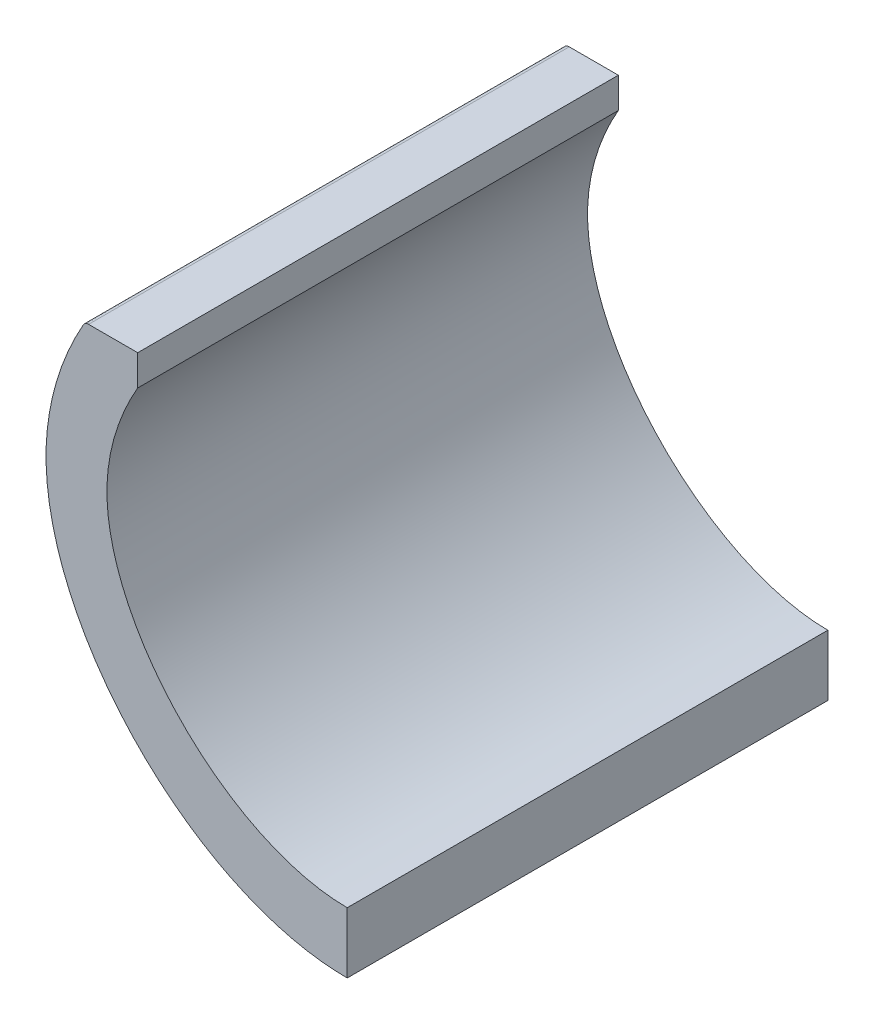
from build123d import *

# Parameters (mm, degrees)
STOCK_PAYLOAD_BAY_1_START = 331.59
STOCK_PAYLOAD_BAY_1_DEPTH = 236.810025
FILLET1_R                 = 3


# Read off the part's stored shape, not the designer's step: Stock-Payload_bay-1
with BuildPart() as part:
    # Stock-Payload_bay-1 outline → Stock-Payload_bay-1 (new body)
    with BuildSketch(Plane.XY.offset(STOCK_PAYLOAD_BAY_1_START)):
        with BuildLine():
            Line((-103.230490722, 66.8), (-129.177697638, 66.8))
            add(Edge.make_bspline(
                [(-129.177697638, 66.8), (-129.620986666, 66.036144557), (-131.753376368, 62.291446965), (-135.362753212, 55.314865151), (-139.587846981, 45.554685292), (-143.085982258, 35.480371977), (-145.768738443, 25.217208127), (-147.598187785, 14.756187222), (-148.496219867, 4.04425788), (-148.371326584, -6.539331808), (-147.273953028, -17.050292148), (-145.252404256, -27.49737261), (-141.377832301, -41.272176246), (-136.008827451, -54.314250652), (-129.322136126, -66.786199843), (-123.638884314, -75.879723374), (-117.410839628, -84.564797072), (-108.463999756, -95.539360338), (-96.108090183, -108.196956109), (-79.329305457, -121.670886231), (-64.299288616, -130.914132781), (-51.579681827, -137.079745612), (-41.624388524, -141.055777896), (-31.440015392, -144.248668387), (-21.132268456, -146.591416073), (-12.406389282, -147.811759094), (-5.350229412, -148.314037414), (-1.78044168, -148.400358856), (0, -148.400358856)],
                knots=[0.118137711, 0.118137711, 0.118137711, 0.118137711, 0.125950211, 0.15625, 0.1875, 0.21875, 0.25, 0.28125, 0.3125, 0.34375, 0.375, 0.40625, 0.4375, 0.5, 0.53125, 0.5625, 0.59375, 0.625, 0.6875, 0.75, 0.8125, 0.84375, 0.875, 0.90625, 0.9375, 0.96875, 0.984375, 1, 1, 1, 1], degree=3))
            Line((0, -148.400358856), (0, -118.400358856))
            add(Edge.make_bspline(
                [(0, -118.400358856), (-2.303693392, -118.400358856), (-6.898551381, -118.2050796), (-16.140086281, -117.063562247), (-27.770620909, -114.278096666), (-41.777508235, -108.787982079), (-52.858828085, -102.773031903), (-61.393202724, -97.151668291), (-67.655072466, -92.508478947), (-73.698942945, -87.500892571), (-79.431014325, -82.211674373), (-84.845879459, -76.652178794), (-91.679619901, -68.852889603), (-97.861381013, -60.540164894), (-103.300564171, -51.770334803), (-106.913108194, -45.10175935), (-110.090532471, -38.300194601), (-113.679857665, -29.149374039), (-116.331962276, -19.674094756), (-117.84305713, -10.383476032), (-118.417692188, -3.496644211), (-118.429616299, 3.303725764), (-117.852853719, 10.322362118), (-116.719335417, 17.290902684), (-115.041411044, 24.294482859), (-112.843468002, 31.263436572), (-109.206181561, 40.566182867), (-105.762926527, 47.378252328), (-103.230490722, 51.742030241)],
                knots=[0.118137711, 0.118137711, 0.118137711, 0.118137711, 0.145695908, 0.173254104, 0.228370497, 0.28348689, 0.338603283, 0.36616148, 0.393719676, 0.421277873, 0.448836069, 0.476394266, 0.503952462, 0.559068856, 0.586627052, 0.614185249, 0.641743445, 0.669301642, 0.724418035, 0.751976231, 0.779534428, 0.807092624, 0.834650821, 0.862209017, 0.889767214, 0.91732541, 0.944883607, 1, 1, 1, 1], degree=3))
            Line((-103.230490722, 51.742030241), (-103.230490722, 66.8))
        make_face()
    extrude(amount=STOCK_PAYLOAD_BAY_1_DEPTH)

    # Fillet1
    fillet1_edges = [part.edges().sort_by_distance(p)[0] for p in [
        (-129.177697638, 66.8, 449.9950125),
    ]]
    fillet(fillet1_edges, radius=FILLET1_R)


solid = part.part
